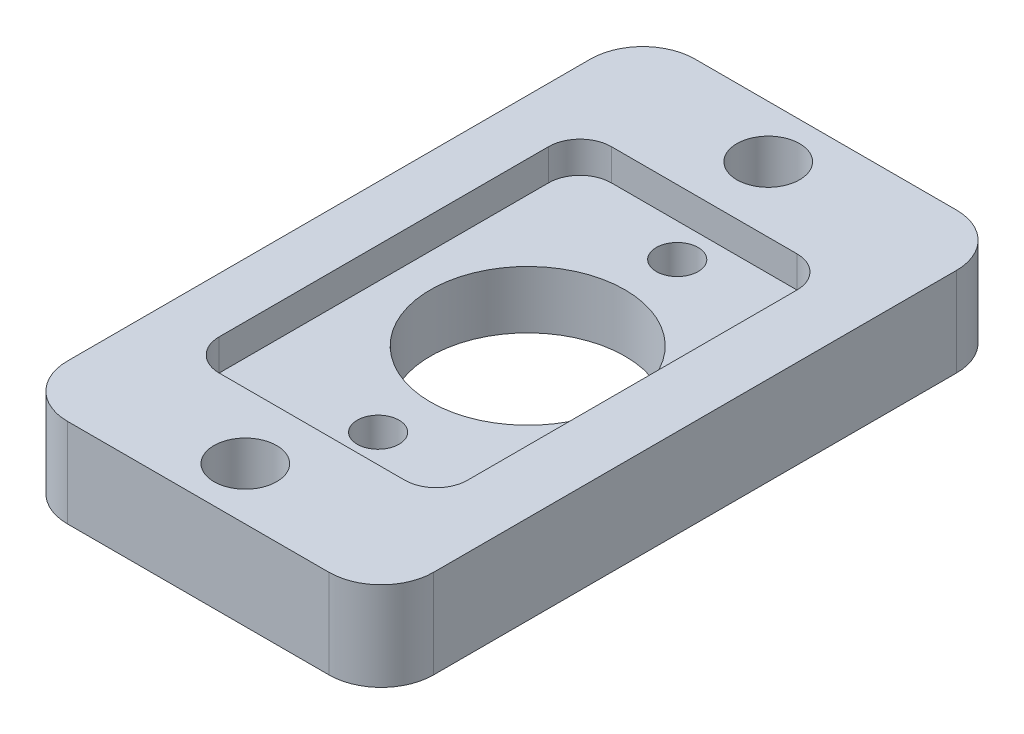
from build123d import *

# Parameters (mm, degrees)
BOSS_EXTRUDE1_DEPTH = 3.4
CUT_EXTRUDE1_DEPTH  = 1.2
SKETCH3_R           = 3.72
SKETCH3_R_2         = 0.8
CUT_EXTRUDE2_DEPTH  = 28.871849598
SKETCH4_R           = 1.2
CUT_EXTRUDE3_DEPTH  = 28.992141754


with BuildPart() as part:
    # Sketch1 → Boss-Extrude1 (new body)
    with BuildSketch(Plane(origin=(0, 0, 0), x_dir=(1, 0, 0), z_dir=(0, 1, 0))):
        with BuildLine():
            Line((2, 0), (12, 0))
            ThreePointArc((12, 0), (13.414213562, -0.585786438), (14, -2))
            Line((14, -2), (14, -22))
            ThreePointArc((14, -22), (13.414213562, -23.414213562), (12, -24))
            Line((12, -24), (2, -24))
            ThreePointArc((2, -24), (0.585786438, -23.414213562), (0, -22))
            Line((0, -22), (0, -2))
            ThreePointArc((0, -2), (0.585786438, -0.585786438), (2, 0))
        make_face()
    extrude(amount=BOSS_EXTRUDE1_DEPTH)

    # Sketch2 → Cut-Extrude1 (cut)
    with BuildSketch(Plane(origin=(0, 3.4, 0), x_dir=(1, 0, 0), z_dir=(0, 1, 0))):
        with BuildLine():
            Line((3.3, -4.5), (10.4, -4.5))
            ThreePointArc((10.4, -4.5), (11.248528137, -4.851471863), (11.6, -5.7))
            Line((11.6, -5.7), (11.6, -18.3))
            ThreePointArc((11.6, -18.3), (11.248528137, -19.148528137), (10.4, -19.5))
            Line((10.4, -19.5), (3.3, -19.5))
            ThreePointArc((3.3, -19.5), (2.451471863, -19.148528137), (2.1, -18.3))
            Line((2.1, -18.3), (2.1, -5.7))
            ThreePointArc((2.1, -5.7), (2.451471863, -4.851471863), (3.3, -4.5))
        make_face()
    extrude(amount=-CUT_EXTRUDE1_DEPTH, mode=Mode.SUBTRACT)

    # Sketch3 → Cut-Extrude2 (cut, through all)
    with BuildSketch(Plane(origin=(0, 2.2, 0), x_dir=(1, 0, 0), z_dir=(0, 1, 0))):
        with Locations((7.1, -11.5)):
            Circle(SKETCH3_R)
        with Locations((7.1, -5.78)):
            Circle(SKETCH3_R_2)
        with Locations((7.1, -17.22)):
            Circle(SKETCH3_R_2)
    extrude(amount=-CUT_EXTRUDE2_DEPTH, mode=Mode.SUBTRACT)

    # Sketch4 → Cut-Extrude3 (cut, through all)
    with BuildSketch(Plane(origin=(0, 3.4, 0), x_dir=(1, 0, 0), z_dir=(0, 1, 0))):
        with Locations((6.8, -2)):
            Circle(SKETCH4_R)
        with Locations((6.8, -22)):
            Circle(SKETCH4_R)
    extrude(amount=-CUT_EXTRUDE3_DEPTH, mode=Mode.SUBTRACT)


solid = part.part
